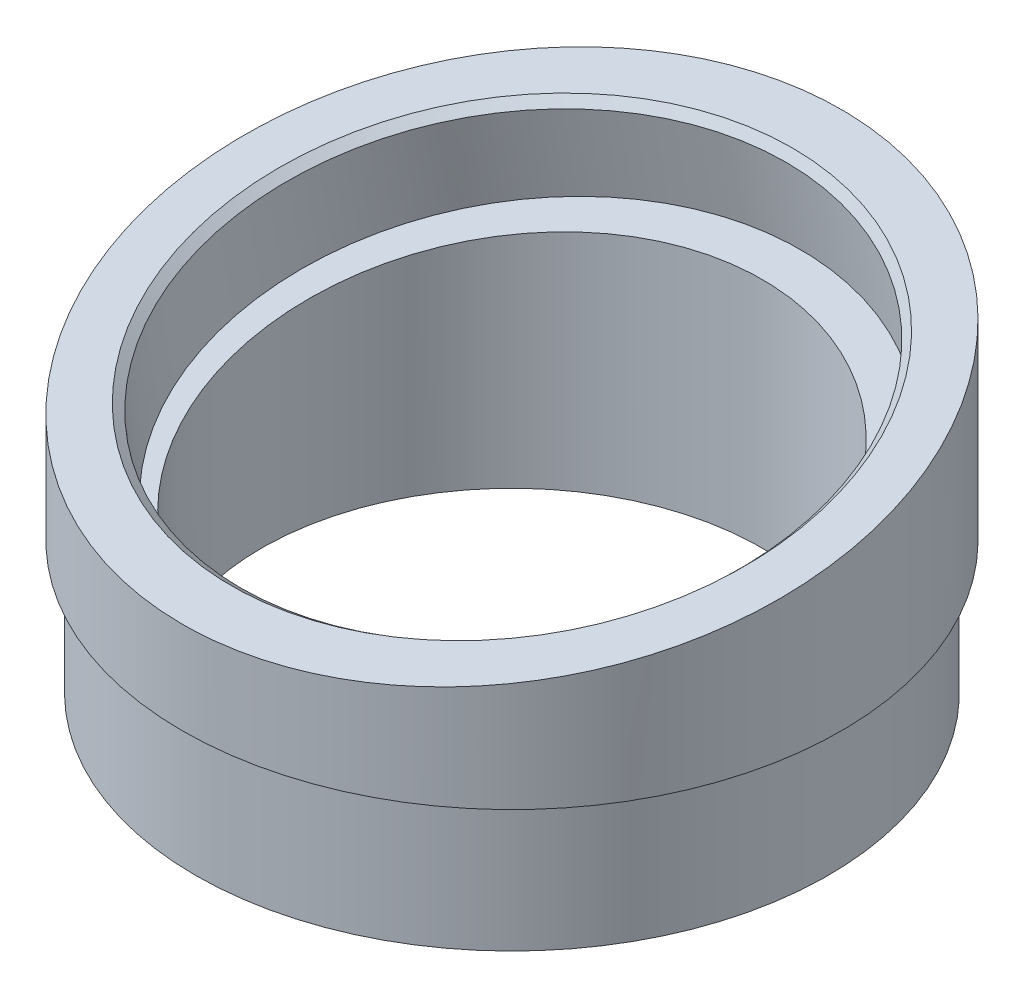
from build123d import *

# Parameters (mm, degrees)
SKETCH_1_R          = 24
SKETCH_1_R_2        = 19
EXTRUDE_1_DEPTH     = 10
SKETCH_2_R          = 25
SKETCH_2_R_2        = 19
EXTRUDE_2_DEPTH     = 20
CUT_EXTRUDE_1_DEPTH = 31
SKETCH_4_R          = 21
CUT_EXTRUDE_2_DEPTH = 7
CHAMFER_1_SIZE      = 0.6


with BuildPart() as part:
    # 草图1 → 凸台-拉伸1 (new body)
    with BuildSketch(Plane(origin=(0, 0, 0), x_dir=(1, 0, 0), z_dir=(0, 1, 0))):
        Circle(SKETCH_1_R)
        Circle(SKETCH_1_R_2, mode=Mode.SUBTRACT)
    extrude(amount=EXTRUDE_1_DEPTH)

    # 草图2 → 凸台-拉伸2 (add)
    with BuildSketch(Plane(origin=(0, 10, 0), x_dir=(1, 0, 0), z_dir=(0, 1, 0))):
        Circle(SKETCH_2_R)
        Circle(SKETCH_2_R_2, mode=Mode.SUBTRACT)
    extrude(amount=EXTRUDE_2_DEPTH)

    # 草图3 → 切除-拉伸1 (cut, symmetric)
    with BuildSketch(Plane(origin=(0, 0, 0), x_dir=(0, 0, -1), z_dir=(1, 0, 0))):
        Polygon((-25, 17), (25, 25.816349035), (25, 47.879470908), (-25, 47.879470908), align=None)
    extrude(amount=CUT_EXTRUDE_1_DEPTH, both=True, mode=Mode.SUBTRACT)

    # 草图4 → 切除-拉伸2 (cut)
    with BuildSketch(Plane(origin=(0, 20.762639068, 3.661013458), x_dir=(1, 0, 0), z_dir=(0, 0.9848077530122079, 0.17364817766693125))):
        with Locations((0, 3.717490492)):
            Circle(SKETCH_4_R)
    extrude(amount=-CUT_EXTRUDE_2_DEPTH, mode=Mode.SUBTRACT)

    # 倒角1
    chamfer_1_edges = [part.edges().sort_by_distance(p)[0] for p in [
        (-21, 21.408174518, 0),
    ]]
    chamfer(chamfer_1_edges, length=CHAMFER_1_SIZE)


solid = part.part
